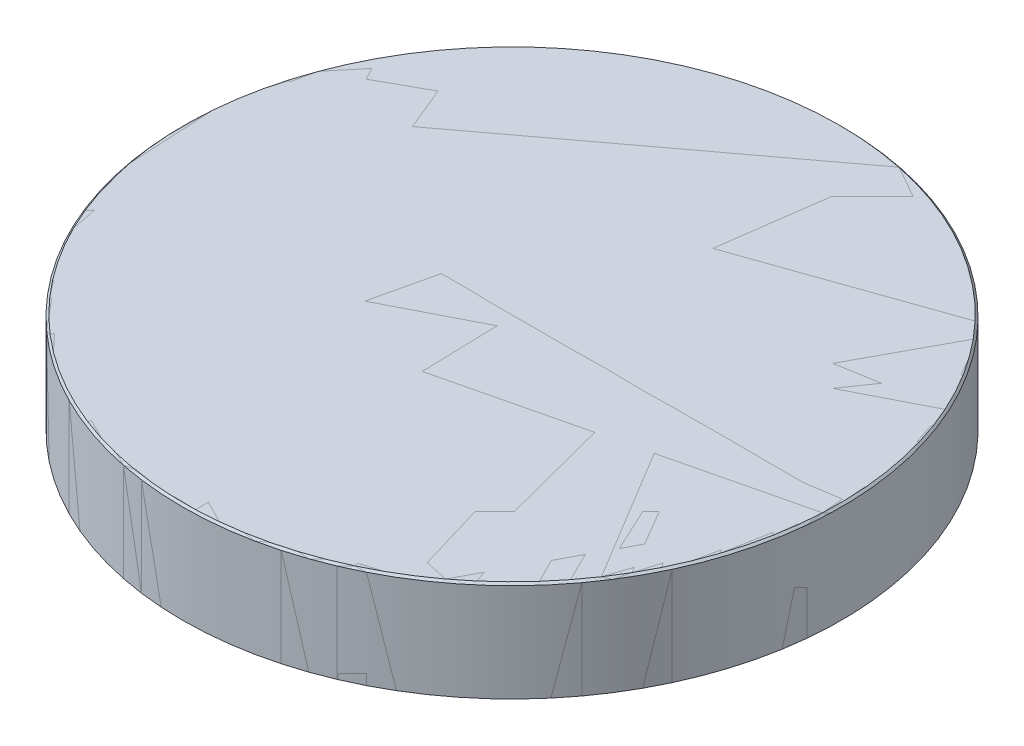
from build123d import *

# Parameters (mm, degrees)
SKETCH3_R           = 4.1783
BOSS_EXTRUDE1_DEPTH = 1.27
CHAMFER1_SIZE       = 0.0254
TEXT_2_W            = 0.0127
TEXT_2_H            = 0.508
CUT_EXTRUDE2_DEPTH  = 0.0254


with BuildPart() as part:
    # Sketch3 → Boss-Extrude1 (new body)
    with BuildSketch(Plane(origin=(0, 0, 0), x_dir=(1, 0, 0), z_dir=(0, 1, 0))):
        Circle(SKETCH3_R)
    extrude(amount=BOSS_EXTRUDE1_DEPTH)

    # Chamfer1
    chamfer1_edges = [part.edges().sort_by_distance(p)[0] for p in [
        (-4.1783, 1.27, 0),
    ]]
    chamfer(chamfer1_edges, length=CHAMFER1_SIZE)

    # Text 2 → Cut-Extrude2 (cut)
    # profile 1 of 15: a face of its own
    with BuildSketch(Plane(origin=(0, 1.27, 0), x_dir=(1, 0, 0), z_dir=(0, 1, 0))):
        Polygon((-3.46075, 0.068857813), (-3.512145313, 0.018355469), (-3.58695625, -0.00635), (-3.685480469, -0.00635), (-3.759497656, 0.019446875), (-3.808710156, 0.067964844), (-3.799879688, 0.077192188), (-3.752552344, 0.030460156), (-3.683496094, 0.00635), (-3.588841406, 0.00635), (-3.518792969, 0.02936875), (-3.47345, 0.074910156), (-3.47345, 0.143073438), (-3.496567969, 0.189210156), (-3.519388281, 0.211534375), (-3.566120313, 0.235644531), (-3.710384375, 0.28336875), (-3.760092969, 0.307478906), (-3.785592188, 0.332878906), (-3.81, 0.382785938), (-3.81, 0.433685156), (-3.759497656, 0.483592188), (-3.685480469, 0.508), (-3.588047656, 0.508), (-3.514030469, 0.484882031), (-3.464421094, 0.436364063), (-3.47345, 0.427335156), (-3.520678125, 0.473670313), (-3.590032031, 0.4953), (-3.683297656, 0.4953), (-3.752353906, 0.472876563), (-3.7973, 0.428823438), (-3.7973, 0.385663281), (-3.775174219, 0.34051875), (-3.750270313, 0.315614844), (-3.703835938, 0.291504688), (-3.560067969, 0.243780469), (-3.510557813, 0.219670313), (-3.485455469, 0.194270313), (-3.46075, 0.1444625), align=None)
    # profile 2 of 15: a face of its own
    with BuildSketch(Plane(origin=(0, 1.27, 0), x_dir=(1, 0, 0), z_dir=(0, 1, 0))):
        Polygon((-2.880617969, 0.502939844), (-3.000474219, 0), (-3.013670313, -0.000396875), (-3.126184375, 0.476646875), (-3.239095313, -0.000297656), (-3.25199375, 0), (-3.37185, 0.502939844), (-3.35994375, 0.508198438), (-3.245445313, 0.02778125), (-3.131740625, 0.508), (-3.120429688, 0.508), (-3.007022656, 0.027384375), (-2.892425, 0.508198438), align=None)
    # profile 3 of 15: a face of its own
    with BuildSketch(Plane(origin=(0, 1.27, 0), x_dir=(1, 0, 0), z_dir=(0, 1, 0))):
        with Locations((-2.7305, 0.254)):
            Rectangle(TEXT_2_W, TEXT_2_H)
    # profile 4 of 15: a face of its own
    with BuildSketch(Plane(origin=(0, 1.27, 0), x_dir=(1, 0, 0), z_dir=(0, 1, 0))):
        Polygon((-2.1844, 0.358675781), (-2.211585938, 0.30876875), (-2.237680469, 0.283269531), (-2.311697656, 0.254), (-2.349797656, 0.254), (-2.1844, 0.002976563), (-2.197596094, -0.000297656), (-2.365077344, 0.254), (-2.52095, 0.254), (-2.52095, 0), (-2.53365, 0), (-2.53365, 0.508), (-2.311697656, 0.508), (-2.237680469, 0.484882031), (-2.211585938, 0.459779688), (-2.1844, 0.409575), align=None)
        Polygon((-2.1971, 0.362049219), (-2.1971, 0.406499219), (-2.223690625, 0.4556125), (-2.239863281, 0.47228125), (-2.313682031, 0.4953), (-2.52095, 0.4953), (-2.52095, 0.2667), (-2.314376563, 0.2667), (-2.244725, 0.294183594), (-2.222003906, 0.316309375), align=None, mode=Mode.SUBTRACT)
    # profile 5 of 15: a face of its own
    with BuildSketch(Plane(origin=(0, 1.27, 0), x_dir=(1, 0, 0), z_dir=(0, 1, 0))):
        Polygon((-1.749722656, -0.00635), (-2.0193, -0.00635), (-2.0193, 0.508), (-2.0066, 0.508), (-2.0066, 0.00635), (-1.749722656, 0.00635), align=None)
    # profile 6 of 15: a face of its own
    with BuildSketch(Plane(origin=(0, 1.27, 0), x_dir=(1, 0, 0), z_dir=(0, 1, 0))):
        with Locations((-1.1049, 0.254)):
            Rectangle(TEXT_2_W, TEXT_2_H)
    # profile 7 of 15: a face of its own
    with BuildSketch(Plane(origin=(0, 1.27, 0), x_dir=(1, 0, 0), z_dir=(0, 1, 0))):
        Polygon((-0.5588, 0), (-0.572889063, 0), (-0.89535, 0.486271094), (-0.89535, 0), (-0.90805, 0), (-0.90805, 0.508), (-0.895052344, 0.50879375), (-0.5715, 0.020736719), (-0.5715, 0.508), (-0.5588, 0.508), align=None)
    # profile 8 of 15: a face of its own
    with BuildSketch(Plane(origin=(0, 1.27, 0), x_dir=(1, 0, 0), z_dir=(0, 1, 0))):
        Polygon((-0.15875, 0.119558594), (-0.186432031, 0.045541406), (-0.211832031, 0.019446875), (-0.261739063, -0.00635), (-0.312638281, -0.00635), (-0.362545313, 0.019446875), (-0.388044531, 0.045541406), (-0.41275, 0.119558594), (-0.41275, 0.168076563), (-0.40005, 0.168076563), (-0.40005, 0.12144375), (-0.376932031, 0.052288281), (-0.35480625, 0.029666406), (-0.309661719, 0.00635), (-0.264616406, 0.00635), (-0.215403906, 0.031849219), (-0.19923125, 0.047525781), (-0.17145, 0.121741406), (-0.17145, 0.508), (-0.15875, 0.508), align=None)
    # profile 9 of 15: a face of its own
    with BuildSketch(Plane(origin=(0, 1.27, 0), x_dir=(1, 0, 0), z_dir=(0, 1, 0))):
        Polygon((0.342800781, -0.00635), (0.0254, -0.00635), (0.0254, 0.508), (0.342800781, 0.508), (0.342800781, 0.4953), (0.0381, 0.4953), (0.0381, 0.2667), (0.22225, 0.2667), (0.22225, 0.254), (0.0381, 0.254), (0.0381, 0.00635), (0.342800781, 0.00635), align=None)
    # profile 10 of 15: a face of its own
    with BuildSketch(Plane(origin=(0, 1.27, 0), x_dir=(1, 0, 0), z_dir=(0, 1, 0))):
        Polygon((0.846534375, 0.117574219), (0.822424219, 0.068659375), (0.773211719, 0.019446875), (0.723007031, -0.00635), (0.624185156, -0.00635), (0.574278125, 0.018553906), (0.524767969, 0.068064063), (0.500955469, 0.117871875), (0.47625, 0.191591406), (0.47625, 0.312142188), (0.501054687, 0.385067969), (0.524767969, 0.434379688), (0.574377344, 0.48339375), (0.624284375, 0.508), (0.723007031, 0.508), (0.773211719, 0.484882031), (0.822424219, 0.435669531), (0.846534375, 0.386754688), (0.835322656, 0.380603125), (0.811907031, 0.428228125), (0.765869531, 0.474166406), (0.720129687, 0.4953), (0.627757031, 0.4953), (0.581917969, 0.472479688), (0.53578125, 0.42624375), (0.511869531, 0.380305469), (0.48895, 0.310455469), (0.48895, 0.193476563), (0.5127625, 0.12303125), (0.536376562, 0.076398438), (0.581917969, 0.029467969), (0.627161719, 0.00635), (0.718244531, 0.00635), (0.763190625, 0.027285156), (0.81200625, 0.0762), (0.835421875, 0.123725781), align=None)
    # profile 11 of 15: a face of its own
    with BuildSketch(Plane(origin=(0, 1.27, 0), x_dir=(1, 0, 0), z_dir=(0, 1, 0))):
        Polygon((1.37795, 0.4953), (1.21285, 0.4953), (1.21285, 0), (1.20015, 0), (1.20015, 0.4953), (1.03505, 0.4953), (1.03505, 0.508), (1.37795, 0.508), align=None)
    # profile 12 of 15: a face of its own
    with BuildSketch(Plane(origin=(0, 1.27, 0), x_dir=(1, 0, 0), z_dir=(0, 1, 0))):
        Polygon((1.8669, 0.191591406), (1.843484375, 0.118169531), (1.819374219, 0.068659375), (1.770161719, 0.019446875), (1.719957031, -0.00635), (1.621135156, -0.00635), (1.571327344, 0.018355469), (1.521717969, 0.067567969), (1.498004687, 0.117078125), (1.4732, 0.190301563), (1.4732, 0.311348438), (1.498004687, 0.384571875), (1.521717969, 0.434082031), (1.571327344, 0.483294531), (1.621234375, 0.508), (1.719957031, 0.508), (1.770161719, 0.484882031), (1.819374219, 0.435669531), (1.843484375, 0.386060156), (1.8669, 0.3127375), align=None)
        Polygon((1.8542, 0.193575781), (1.8542, 0.311050781), (1.831776562, 0.381099219), (1.809055469, 0.427930469), (1.762819531, 0.474166406), (1.717079687, 0.4953), (1.624707031, 0.4953), (1.578867969, 0.472380469), (1.53273125, 0.425846875), (1.508819531, 0.379710156), (1.4859, 0.309661719), (1.4859, 0.191988281), (1.508621094, 0.121939844), (1.532334375, 0.075803125), (1.578173437, 0.029269531), (1.623615625, 0.00635), (1.715194531, 0.00635), (1.760339062, 0.027384375), (1.80895625, 0.076100781), (1.831677344, 0.122932031), align=None, mode=Mode.SUBTRACT)
    # profile 13 of 15: a face of its own
    with BuildSketch(Plane(origin=(0, 1.27, 0), x_dir=(1, 0, 0), z_dir=(0, 1, 0))):
        Polygon((2.3876, 0.358675781), (2.360414062, 0.30876875), (2.334319531, 0.283269531), (2.260302344, 0.254), (2.222202344, 0.254), (2.3876, 0.002976563), (2.374403906, -0.000297656), (2.206922656, 0.254), (2.05105, 0.254), (2.05105, 0), (2.03835, 0), (2.03835, 0.508), (2.260302344, 0.508), (2.334319531, 0.484882031), (2.360414062, 0.459779688), (2.3876, 0.409575), align=None)
        Polygon((2.3749, 0.362049219), (2.3749, 0.406499219), (2.348309375, 0.4556125), (2.332136719, 0.47228125), (2.258317969, 0.4953), (2.05105, 0.4953), (2.05105, 0.2667), (2.257623437, 0.2667), (2.327275, 0.294183594), (2.349996094, 0.316309375), align=None, mode=Mode.SUBTRACT)
    # profile 14 of 15: a face of its own
    with BuildSketch(Plane(origin=(0, 1.27, 0), x_dir=(1, 0, 0), z_dir=(0, 1, 0))):
        Polygon((3.390602344, 0.502344531), (3.199804688, 0), (3.188394531, 0), (2.9972, 0.502344531), (3.008411719, 0.508694531), (3.19405, 0.020835938), (3.379390625, 0.508694531), align=None)
    # profile 15 of 15: a face of its own
    with BuildSketch(Plane(origin=(0, 1.27, 0), x_dir=(1, 0, 0), z_dir=(0, 1, 0))):
        Polygon((3.6957, 0), (3.683, 0), (3.683, 0.4841875), (3.623865625, 0.426442188), (3.575248438, 0.401935156), (3.5687, 0.412849219), (3.616325, 0.436959375), (3.689250781, 0.508), (3.6957, 0.508), align=None)
    extrude(amount=-CUT_EXTRUDE2_DEPTH, mode=Mode.SUBTRACT)


with BuildPart() as body_2:
    # Spun Profile Sketch1 → Revolve 2 (revolve)
    with BuildSketch(Plane(origin=(0, 1.27, 0), x_dir=(0, 1, 0), z_dir=(1, 0, 0))):
        Polygon((-1.27, 0), (0, 0), (0, 4.1529), (-0.0254, 4.1783), (-1.27, 4.1783), align=None)
    revolve(axis=Axis((0, 1.27, 0), (0, 1, 0)))


solid = Compound([part.part, body_2.part])
